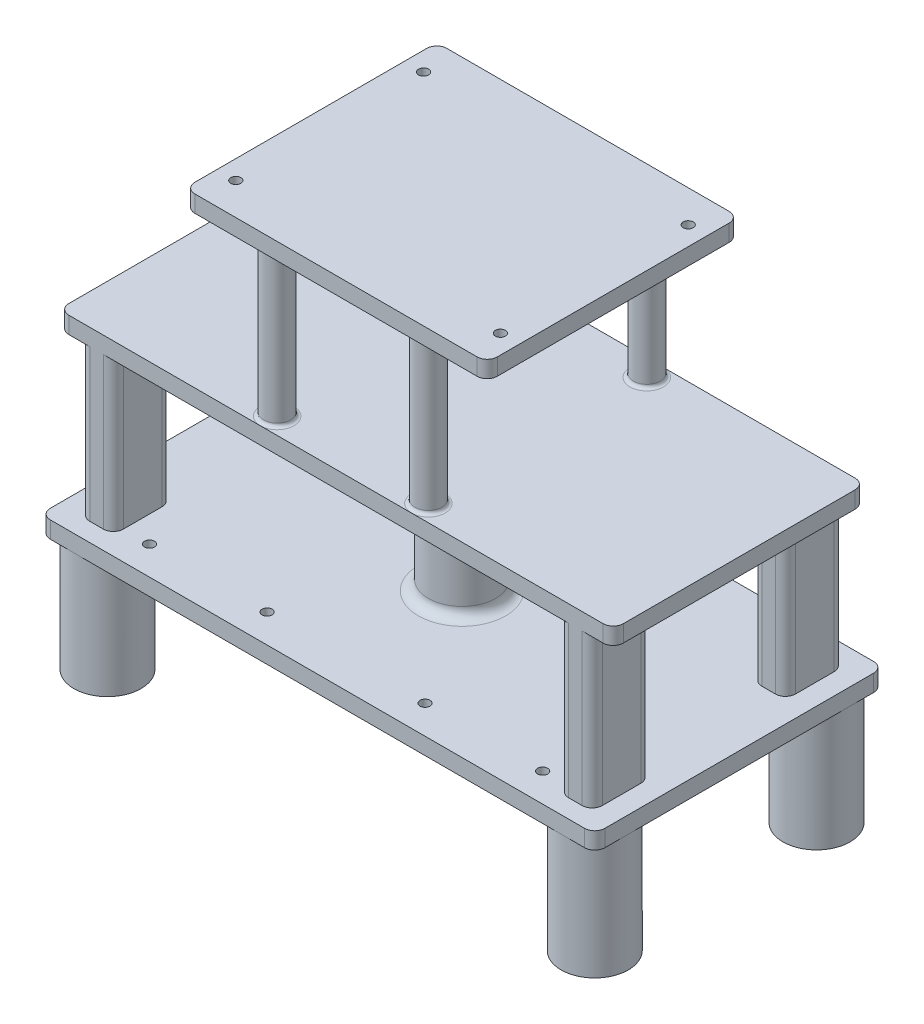
from build123d import *

# Parameters (mm, degrees)
SKETCH1_R             = 10
SKETCH1_R_2           = 5
BOSS_EXTRUDE1_DEPTH   = 35
BOSS_EXTRUDE1_2_DEPTH = 35
BOSS_EXTRUDE1_3_DEPTH = 35
BOSS_EXTRUDE1_4_DEPTH = 35
SKETCH2_W             = 165
SKETCH2_H             = 86
BOSS_EXTRUDE2_DEPTH   = 5
SKETCH3_R             = 1.5
CUT_EXTRUDE1_DEPTH    = 5
SKETCH4_W             = 10
SKETCH4_H             = 17.5
SKETCH4_R             = 10
SKETCH4_R_2           = 5
BOSS_EXTRUDE3_DEPTH   = 45
SKETCH5_W             = 165
SKETCH5_H             = 75
BOSS_EXTRUDE4_DEPTH   = 5
SKETCH6_R             = 4
BOSS_EXTRUDE5_DEPTH   = 45
SKETCH7_W             = 90
SKETCH7_H             = 75
BOSS_EXTRUDE6_DEPTH   = 5
SKETCH8_R             = 1.5
CUT_EXTRUDE3_DEPTH    = 5
FILLET2_R             = 3
FILLET3_R             = 3
FILLET4_R             = 1


with BuildPart() as part:
    # Sketch1 → Boss-Extrude1 (new body)
    with BuildSketch(Plane(origin=(0, 0, 0), x_dir=(1, 0, 0), z_dir=(0, 1, 0))):
        with Locations(Location((-72.5, -33, 0), (0, 0, 270))):
            Circle(SKETCH1_R)
        with Locations(Location((-72.5, -33, 0), (0, 0, 270))):
            Circle(SKETCH1_R_2, mode=Mode.SUBTRACT)
    extrude(amount=BOSS_EXTRUDE1_DEPTH)



with BuildPart() as body_2:
    # Sketch1 → Boss-Extrude1 2 (new body)
    with BuildSketch(Plane(origin=(0, 0, 0), x_dir=(1, 0, 0), z_dir=(0, 1, 0))):
        with Locations(Location((-72.5, 33, 0), (0, 0, 270))):
            Circle(SKETCH1_R)
        with Locations(Location((-72.5, 33, 0), (0, 0, 270))):
            Circle(SKETCH1_R_2, mode=Mode.SUBTRACT)
    extrude(amount=BOSS_EXTRUDE1_2_DEPTH)


with BuildPart() as body_3:
    # Sketch1 → Boss-Extrude1 3 (new body)
    with BuildSketch(Plane(origin=(0, 0, 0), x_dir=(1, 0, 0), z_dir=(0, 1, 0))):
        with Locations(Location((72.5, -33, 0), (0, 0, 270))):
            Circle(SKETCH1_R)
        with Locations(Location((72.5, -33, 0), (0, 0, 270))):
            Circle(SKETCH1_R_2, mode=Mode.SUBTRACT)
    extrude(amount=BOSS_EXTRUDE1_3_DEPTH)


with BuildPart() as body_4:
    # Sketch1 → Boss-Extrude1 4 (new body)
    with BuildSketch(Plane(origin=(0, 0, 0), x_dir=(1, 0, 0), z_dir=(0, 1, 0))):
        with Locations(Location((72.5, 33, 0), (0, 0, 270))):
            Circle(SKETCH1_R)
        with Locations(Location((72.5, 33, 0), (0, 0, 270))):
            Circle(SKETCH1_R_2, mode=Mode.SUBTRACT)
    extrude(amount=BOSS_EXTRUDE1_4_DEPTH)


with BuildPart() as part_1:
    add(part.part)

    add(body_2.part)  # Boss-Extrude2 merges body 2

    add(body_3.part)  # Boss-Extrude2 merges body 3

    add(body_4.part)  # Boss-Extrude2 merges body 4
    # Sketch2 → Boss-Extrude2 (add)
    with BuildSketch(Plane(origin=(0, 35, 0), x_dir=(1, 0, 0), z_dir=(0, 1, 0))):
        Rectangle(SKETCH2_W, SKETCH2_H)
    extrude(amount=BOSS_EXTRUDE2_DEPTH)

    # Sketch3 → Cut-Extrude1 (cut)
    with BuildSketch(Plane(origin=(0, 40, 0), x_dir=(1, 0, 0), z_dir=(0, 1, 0))):
        with Locations(Location((-58.5, 34.5, 0), (0, 0, 270))):
            Circle(SKETCH3_R)
        with Locations(Location((-23.5, 34.5, 0), (0, 0, 270))):
            Circle(SKETCH3_R)
        with Locations(Location((-58.5, -34.5, 0), (0, 0, 270))):
            Circle(SKETCH3_R)
        with Locations(Location((-23.5, -34.5, 0), (0, 0, 270))):
            Circle(SKETCH3_R)
    cut_extrude1 = extrude(amount=-CUT_EXTRUDE1_DEPTH, mode=Mode.SUBTRACT)

    # Mirror1: Cut-Extrude1 across plane
    add(cut_extrude1.mirror(Plane(origin=(0, 0, 0), x_dir=(0, 0, 1), z_dir=(1, 0, 0))), mode=Mode.SUBTRACT)

    # Sketch4 → Boss-Extrude3 (add)
    # profile 1 of 5: a face of its own
    with BuildSketch(Plane(origin=(0, 40, 0), x_dir=(1, 0, 0), z_dir=(0, 1, 0))):
        with Locations((-71.25, 28.75)):
            Rectangle(SKETCH4_W, SKETCH4_H)
    # profile 2 of 5: a face of its own
    with BuildSketch(Plane(origin=(0, 40, 0), x_dir=(1, 0, 0), z_dir=(0, 1, 0))):
        with Locations((-71.25, -28.75)):
            Rectangle(SKETCH4_W, SKETCH4_H)
    # profile 3 of 5: a face of its own
    with BuildSketch(Plane(origin=(0, 40, 0), x_dir=(1, 0, 0), z_dir=(0, 1, 0))):
        with Locations(Location((0, 0, 0), (0, 0, 90))):
            Circle(SKETCH4_R)
        with Locations(Location((0, 0, 0), (0, 0, 90))):
            Circle(SKETCH4_R_2, mode=Mode.SUBTRACT)
    # profile 4 of 5: a face of its own
    with BuildSketch(Plane(origin=(0, 40, 0), x_dir=(1, 0, 0), z_dir=(0, 1, 0))):
        with Locations((71.25, 28.75)):
            Rectangle(SKETCH4_W, SKETCH4_H)
    # profile 5 of 5: a face of its own
    with BuildSketch(Plane(origin=(0, 40, 0), x_dir=(1, 0, 0), z_dir=(0, 1, 0))):
        with Locations((71.25, -28.75)):
            Rectangle(SKETCH4_W, SKETCH4_H)
    extrude(amount=BOSS_EXTRUDE3_DEPTH)

    # Sketch5 → Boss-Extrude4 (add)
    with BuildSketch(Plane(origin=(0, 85, 0), x_dir=(1, 0, 0), z_dir=(0, 1, 0))):
        Rectangle(SKETCH5_W, SKETCH5_H)
    extrude(amount=BOSS_EXTRUDE4_DEPTH)

    # Sketch6 → Boss-Extrude5 (add)
    with BuildSketch(Plane(origin=(0, 90, 0), x_dir=(1, 0, 0), z_dir=(0, 1, 0))):
        with Locations(Location((-22.5, 32.5, 0), (0, 0, 90))):
            Circle(SKETCH6_R)
        with Locations(Location((-22.5, -32.5, 0), (0, 0, 90))):
            Circle(SKETCH6_R)
    boss_extrude5 = extrude(amount=BOSS_EXTRUDE5_DEPTH)

    # Mirror2: Boss-Extrude5 across plane
    add(boss_extrude5.mirror(Plane(origin=(0, 0, 0), x_dir=(0, 0, 1), z_dir=(1, 0, 0))))

    # Sketch7 → Boss-Extrude6 (add)
    with BuildSketch(Plane(origin=(0, 135, 0), x_dir=(1, 0, 0), z_dir=(0, 1, 0))):
        Rectangle(SKETCH7_W, SKETCH7_H)
    extrude(amount=BOSS_EXTRUDE6_DEPTH)

    # Sketch8 → Cut-Extrude3 (cut)
    with BuildSketch(Plane(origin=(0, 140, 0), x_dir=(1, 0, 0), z_dir=(0, 1, 0))):
        with Locations(Location((39.37, -27.94, 0), (0, 0, 270))):
            Circle(SKETCH8_R)
        with Locations(Location((-39.37, -27.94, 0), (0, 0, 270))):
            Circle(SKETCH8_R)
        with Locations(Location((39.37, 27.94, 0), (0, 0, 270))):
            Circle(SKETCH8_R)
        with Locations(Location((-39.37, 27.94, 0), (0, 0, 270))):
            Circle(SKETCH8_R)
    extrude(amount=-CUT_EXTRUDE3_DEPTH, mode=Mode.SUBTRACT)

    # Fillet2
    fillet2_edges = [part_1.edges().sort_by_distance(p)[0] for p in [
        (82.5, 37.5, -43),
        (-82.5, 37.5, -43),
        (66.25, 62.5, -37.5),
        (66.25, 62.5, -20),
        (76.25, 62.5, -20),
        (76.25, 62.5, -37.5),
        (-82.5, 37.5, 43),
        (76.25, 62.5, 20),
        (66.25, 62.5, 20),
        (66.25, 62.5, 37.5),
        (76.25, 62.5, 37.5),
        (82.5, 87.5, 37.5),
        (82.5, 87.5, -37.5),
        (-82.5, 87.5, -37.5),
        (-82.5, 87.5, 37.5),
        (45, 137.5, 37.5),
        (45, 137.5, -37.5),
        (-45, 137.5, -37.5),
        (-45, 137.5, 37.5),
        (-76.25, 62.5, -37.5),
        (-76.25, 62.5, -20),
        (-66.25, 62.5, -20),
        (-66.25, 62.5, -37.5),
        (-66.25, 62.5, 20),
        (-76.25, 62.5, 20),
        (-76.25, 62.5, 37.5),
        (-66.25, 62.5, 37.5),
        (82.5, 37.5, 43),
    ]]
    fillet(fillet2_edges, radius=FILLET2_R)

    # Fillet3
    fillet3_edges = [part_1.edges().sort_by_distance(p)[0] for p in [
        (0, 40, 10),
        (0, 85, 10),
    ]]
    fillet(fillet3_edges, radius=FILLET3_R)

    # Fillet4
    fillet4_edges = [part_1.edges().sort_by_distance(p)[0] for p in [
        (-22.5, 90, -28.5),
        (-22.5, 135, -28.5),
        (-22.5, 90, 36.5),
        (-22.5, 135, 36.5),
        (22.5, 90, -28.5),
        (22.5, 90, 36.5),
        (22.5, 135, -28.5),
        (22.5, 135, 36.5),
    ]]
    fillet(fillet4_edges, radius=FILLET4_R - 0.0001)  # a hair under: the kernel refuses the full size


solid = part_1.part
